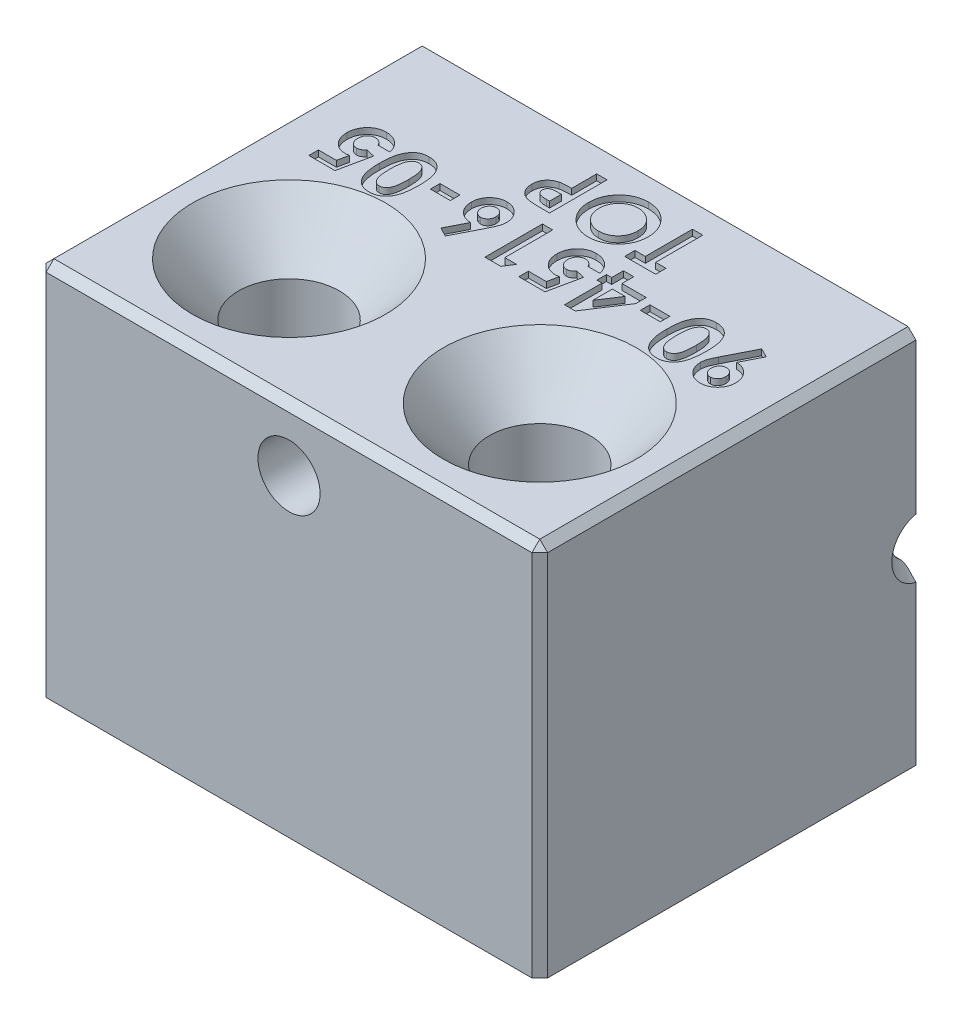
from build123d import *

# Parameters (mm, degrees)
CROQUIS1_W                                           = 25.4
CROQUIS1_H                                           = 19.05
SALIENTE_EXTRUIR1_DEPTH                              = 19.05
AVELLANADO_PARA_TORNILLO_CON_CABEZA_OVAL_D           = 5.1054
AVELLANADO_PARA_TORNILLO_CON_CABEZA_OVAL_CSINK_D     = 9.779
AVELLANADO_PARA_TORNILLO_CON_CABEZA_OVAL_CSINK_ANGLE = 82
CROQUIS6_R                                           = 7.112
CORTAR_EXTRUIR2_DEPTH                                = 6.35
CORTAR_EXTRUIR2_TAPER                                = 45
CROQUIS8_R                                           = 0.8636
CORTAR_EXTRUIR3_DEPTH                                = 34.147973166
REDONDEO1_R                                          = 0.508
CHAFL_N3_SIZE                                        = 0.6604
TALADROS_DE_ESPIGA_DE_1_8_0_124_2_D                  = 3.1496
CROQUIS11_W                                          = 1.007451923
CROQUIS11_H                                          = 0.485069445
CORTAR_EXTRUIR4_DEPTH                                = 0.3048
CHAFL_N4_SIZE                                        = 0.396875


with BuildPart() as part:
    # Croquis1 → Saliente-Extruir1 (new body)
    with BuildSketch(Plane(origin=(0, 0, 0), x_dir=(1, 0, 0), z_dir=(0, 1, 0))):
        Rectangle(CROQUIS1_W, CROQUIS1_H)
    extrude(amount=SALIENTE_EXTRUIR1_DEPTH)

    # Avellanado para tornillo con cabeza ovalada de #101 (through all)
    with Locations(Plane(origin=(0, 19.05, 0), x_dir=(1, 0, 0), z_dir=(0, 1, 0))):
        with Locations((-6.35, -3.175), (6.35, -3.175)):
            CounterSinkHole(AVELLANADO_PARA_TORNILLO_CON_CABEZA_OVAL_D / 2, AVELLANADO_PARA_TORNILLO_CON_CABEZA_OVAL_CSINK_D / 2, counter_sink_angle=AVELLANADO_PARA_TORNILLO_CON_CABEZA_OVAL_CSINK_ANGLE)

    # Croquis6 → Cortar-Extruir2 (cut)
    with BuildSketch(Plane(origin=(-12.7, 0, 0), x_dir=(0, 0, -1), z_dir=(1, 0, 0))):
        with Locations((9.525, 9.525)):
            Circle(CROQUIS6_R)
    extrude(amount=CORTAR_EXTRUIR2_DEPTH, taper=CORTAR_EXTRUIR2_TAPER, mode=Mode.SUBTRACT)

    # Croquis8 → Cortar-Extruir3 (cut, through all)
    with BuildSketch(Plane(origin=(12.7, 0, 0), x_dir=(0, 0, -1), z_dir=(1, 0, 0))):
        with Locations((9.8298, 9.525)):
            Circle(CROQUIS8_R)
    extrude(amount=-CORTAR_EXTRUIR3_DEPTH, mode=Mode.SUBTRACT)

    # Redondeo1
    redondeo1_edges = [part.edges().sort_by_distance(p)[0] for p in [
        (3.151988267, 10.333023465, -9.525),
        (3.151988267, 8.716976535, -9.525),
    ]]
    fillet(redondeo1_edges, radius=REDONDEO1_R)

    # Chaflán3
    # the kernel refuses this chamfer: 0.6604 mm, written as the material it takes off along each edge
    with BuildSketch(Plane(origin=(12.7, 9.525, -9.8298), x_dir=(0, 0.2351427909477186, -0.9719608365903007), z_dir=(0, -0.9719608365903007, -0.2351427909477186))) as chafl_n3_piece_1:
        Polygon((0.8636 + CHAFL_N3_SIZE, 0), (0.8636, -CHAFL_N3_SIZE), (0.8636, 0), align=None)
    revolve(axis=Axis((12.7, 9.525, -9.8298), (1, 0, 0)), revolution_arc=332.799920084, mode=Mode.SUBTRACT)

    # Taladros de espiga de 1/8 (0.124)2 (through all)
    with Locations(Plane.XY.offset(9.525)):
        with Locations((0, 15.875)):
            Hole(TALADROS_DE_ESPIGA_DE_1_8_0_124_2_D / 2)

    # Croquis11 → Cortar-Extruir4 (cut)
    # profile 1 of 13: a face of its own
    with BuildSketch(Plane(origin=(0, 19.05, 0), x_dir=(1, 0, 0), z_dir=(0, 1, 0))):
        with BuildLine():
            Line((9.577789463, 4.837126068), (10.040704294, 4.603919605))
            Line((10.040704294, 4.603919605), (9.533480235, 3.60579594))
            add(Edge.make_bspline(
                [(9.533480235, 3.60579594), (9.563448151, 3.605032039), (9.622282421, 3.603532316), (9.708912078, 3.591071396), (9.79175089, 3.569795359), (9.871789683, 3.541486874), (9.947868003, 3.503479265), (10.021214324, 3.458267026), (10.08991352, 3.403116411), (10.155610898, 3.3420509), (10.215039209, 3.27437186), (10.267524351, 3.202058036), (10.311966693, 3.125805433), (10.347643135, 3.045101646), (10.375663566, 2.960750955), (10.396330159, 2.872422475), (10.407892867, 2.779776454), (10.409512185, 2.716727179), (10.410336538, 2.684630409)],
                knots=[0, 0, 0, 0, 1.014438208, 1.991587644, 2.955575466, 3.906834206, 4.860343588, 5.829907848, 6.818577787, 7.838125475, 8.863876483, 9.862937823, 10.859547262, 11.846397878, 12.845242478, 13.865236027, 14.913246352, 16, 16, 16, 16], degree=3))
            add(Edge.make_bspline(
                [(10.410336538, 2.684630409), (10.409573729, 2.653495901), (10.408070628, 2.592145999), (10.395554211, 2.502114167), (10.375037279, 2.415632496), (10.34654624, 2.332727926), (10.309665397, 2.253544829), (10.264124726, 2.178415871), (10.211148448, 2.106509365), (10.150056989, 2.039510929), (10.083930079, 1.978163774), (10.013245825, 1.924776205), (9.939828617, 1.87873473), (9.862104989, 1.842156005), (9.781495191, 1.812463397), (9.696932133, 1.792376454), (9.609268662, 1.779720186), (9.549654258, 1.778217608), (9.519487847, 1.777457265)],
                knots=[0, 0, 0, 0, 1.05547428, 2.079790231, 3.075662031, 4.065650429, 5.047466705, 6.031911617, 7.04026589, 8.071428158, 9.102169131, 10.094698886, 11.071325611, 12.035261792, 13.002593907, 13.979242867, 14.977445265, 16, 16, 16, 16], degree=3))
            add(Edge.make_bspline(
                [(9.519487847, 1.777457265), (9.487952388, 1.778106656), (9.425942175, 1.779383596), (9.335164644, 1.793464624), (9.248323544, 1.815087058), (9.165013381, 1.844385431), (9.086555771, 1.884358568), (9.011455772, 1.931317465), (8.941168862, 1.988182894), (8.875334679, 2.052157374), (8.816066917, 2.122334502), (8.763226354, 2.195185927), (8.718310177, 2.270936113), (8.682431228, 2.349637811), (8.653902647, 2.430750253), (8.634463923, 2.514452874), (8.621524541, 2.600663398), (8.620054757, 2.65912436), (8.619310897, 2.688711522)],
                knots=[0, 0, 0, 0, 1.062709067, 2.08967359, 3.089490552, 4.078335371, 5.060205664, 6.052952122, 7.060109841, 8.102908433, 9.144326257, 10.153805576, 11.135063239, 12.108674621, 13.066249871, 14.029571809, 15.002763993, 16, 16, 16, 16], degree=3))
            add(Edge.make_bspline(
                [(8.619310897, 2.688711522), (8.619719437, 2.711276442), (8.620542329, 2.756727266), (8.628532622, 2.824700174), (8.640822501, 2.89284773), (8.655155237, 2.950249112), (8.669572085, 2.998831209), (8.684563196, 3.039928146), (8.702643179, 3.085723191), (8.723569729, 3.136286822), (8.747510973, 3.19136855), (8.775282981, 3.250776954), (8.805131663, 3.31542236), (8.827136705, 3.359624711), (8.838524973, 3.382500751)],
                knots=[0, 0, 0, 0, 1.105166677, 2.22605417, 3.348517788, 4.496260522, 5.122810462, 5.830557215, 6.638607343, 7.535109037, 8.511576286, 9.580928918, 10.748058253, 12, 12, 12, 12], degree=3))
            Line((8.838524973, 3.382500751), (9.577789463, 4.837126068))
        make_face()
        with BuildLine():
            add(Edge.make_bspline(
                [(9.507827524, 3.120726496), (9.482795045, 3.11925523), (9.433887248, 3.116380711), (9.363669857, 3.09408565), (9.30057588, 3.056049176), (9.245231346, 3.004811297), (9.19915939, 2.943213682), (9.165400287, 2.873227517), (9.144932888, 2.795967391), (9.142793956, 2.742087786), (9.141693376, 2.714364233)],
                knots=[0, 0, 0, 0, 0.984989413, 1.924446292, 2.868477643, 3.865502828, 4.877610339, 5.88087679, 6.909612885, 8, 8, 8, 8], degree=3))
            add(Edge.make_bspline(
                [(9.141693376, 2.714364233), (9.142994568, 2.68605368), (9.145525697, 2.630982896), (9.166529174, 2.551919907), (9.201282439, 2.480001458), (9.249824037, 2.417666835), (9.306830128, 2.365927934), (9.370038466, 2.327663681), (9.438400041, 2.304156881), (9.485687237, 2.301288726), (9.509576573, 2.299839744)],
                knots=[0, 0, 0, 0, 1.10379546, 2.14714571, 3.168417875, 4.20176326, 5.211701457, 6.157576563, 7.069213742, 8, 8, 8, 8], degree=3))
            add(Edge.make_bspline(
                [(9.509576573, 2.299839744), (9.534825447, 2.301253068), (9.584401405, 2.304028119), (9.655559168, 2.327469177), (9.720858364, 2.364895485), (9.77874715, 2.41654012), (9.827685766, 2.478548122), (9.86248368, 2.550408234), (9.884294391, 2.629139345), (9.886712236, 2.684289592), (9.88795406, 2.712615184)],
                knots=[0, 0, 0, 0, 0.970853505, 1.906262912, 2.855477211, 3.852937491, 4.877462982, 5.878766514, 6.910518104, 8, 8, 8, 8], degree=3))
            add(Edge.make_bspline(
                [(9.88795406, 2.712615184), (9.886582137, 2.740517465), (9.883916325, 2.794734968), (9.863924526, 2.872907949), (9.828743893, 2.943141503), (9.78143682, 3.00505469), (9.724224966, 3.056280847), (9.658567158, 3.094384581), (9.585178842, 3.116333746), (9.534012254, 3.119239476), (9.507827524, 3.120726496)],
                knots=[0, 0, 0, 0, 1.075564157, 2.089951178, 3.085472164, 4.085356838, 5.078137244, 6.028240785, 6.99094342, 8, 8, 8, 8], degree=3))
        make_face(mode=Mode.SUBTRACT)
    # profile 2 of 13: a face of its own
    with BuildSketch(Plane(origin=(0, 19.05, 0), x_dir=(1, 0, 0), z_dir=(0, 1, 0))):
        with BuildLine():
            add(Edge.make_bspline(
                [(7.303443426, 1.777457265), (7.278157881, 1.77783251), (7.228439743, 1.778570343), (7.155215401, 1.786566107), (7.08467583, 1.79863628), (7.016565039, 1.815502545), (6.951300749, 1.837707433), (6.88860013, 1.864735669), (6.828309878, 1.896085583), (6.770975299, 1.933017916), (6.71682924, 1.975040034), (6.665498574, 2.022025215), (6.618042906, 2.074736225), (6.572776059, 2.13188631), (6.531493699, 2.194734624), (6.493018566, 2.262255631), (6.457935714, 2.335171172), (6.425755776, 2.413531194), (6.39696918, 2.498530334), (6.372790314, 2.591151055), (6.351770035, 2.691327551), (6.335215941, 2.799581534), (6.321666816, 2.915657696), (6.312813966, 3.039773229), (6.306655314, 3.171580804), (6.306158182, 3.262002964), (6.305902778, 3.308457699)],
                knots=[0, 0, 0, 0, 0.879038005, 1.72842358, 2.558443055, 3.366573136, 4.165922485, 4.953092809, 5.739101687, 6.526504095, 7.321412341, 8.120218626, 8.943108119, 9.785446297, 10.653345205, 11.555363108, 12.486387694, 13.465363381, 14.499809521, 15.604758044, 16.79243262, 18.058048538, 19.411969755, 20.855614229, 22.384559651, 24, 24, 24, 24], degree=3))
            add(Edge.make_bspline(
                [(6.305902778, 3.308457699), (6.30618078, 3.355493333), (6.306720933, 3.446882727), (6.312539159, 3.579900007), (6.322561587, 3.704902354), (6.335469274, 3.821880127), (6.353183482, 3.930760397), (6.37378088, 4.031678931), (6.398613648, 4.124661507), (6.428192408, 4.209693066), (6.460341747, 4.288314568), (6.495211194, 4.361120545), (6.532778164, 4.428681974), (6.572635594, 4.491157023), (6.616097425, 4.547771499), (6.661366848, 4.599351895), (6.709735991, 4.64517628), (6.760423898, 4.686227022), (6.814677143, 4.722158218), (6.872253198, 4.753028481), (6.933541606, 4.778539733), (6.997650491, 4.800528892), (7.065720417, 4.816349019), (7.136700339, 4.828891434), (7.211382998, 4.835825388), (7.262230296, 4.836685393), (7.288285006, 4.837126068)],
                knots=[0, 0, 0, 0, 1.643729521, 3.193736973, 4.651750042, 6.025799905, 7.305391353, 8.505533933, 9.624215592, 10.665924642, 11.64969722, 12.591402044, 13.485259159, 14.34997443, 15.17859563, 15.977254476, 16.745893235, 17.504291679, 18.254003551, 19.016677942, 19.783634514, 20.571857866, 21.382327253, 22.223106266, 23.08950026, 24, 24, 24, 24], degree=3))
            add(Edge.make_bspline(
                [(7.288285006, 4.837126068), (7.314338454, 4.836674907), (7.365376774, 4.835791087), (7.440269243, 4.828965006), (7.511783222, 4.816186583), (7.580495193, 4.800641949), (7.645751621, 4.77837586), (7.708295634, 4.752632302), (7.76705824, 4.720755476), (7.823123917, 4.685137239), (7.875595572, 4.644080672), (7.925254138, 4.598240661), (7.972793395, 4.54825711), (8.016519925, 4.492393926), (8.057215636, 4.431671333), (8.095312847, 4.366097865), (8.130036079, 4.29545891), (8.162553151, 4.219774559), (8.191301043, 4.137224752), (8.216176269, 4.047049902), (8.23689715, 3.948475347), (8.254636576, 3.84193807), (8.266664153, 3.726824151), (8.276917028, 3.603812197), (8.282660924, 3.472534433), (8.283210589, 3.382311557), (8.28349359, 3.335859458)],
                knots=[0, 0, 0, 0, 0.917300563, 1.796978314, 2.644037383, 3.473869551, 4.274468802, 5.068727038, 5.852392514, 6.624895937, 7.405058545, 8.194438634, 9.002807344, 9.831001702, 10.688798588, 11.574866558, 12.499006576, 13.458565112, 14.473491784, 15.574131657, 16.749764288, 18.018652109, 19.374999853, 20.823441246, 22.364518758, 24, 24, 24, 24], degree=3))
            add(Edge.make_bspline(
                [(8.28349359, 3.335859458), (8.282986796, 3.271318161), (8.282008931, 3.146784895), (8.269934427, 2.966845157), (8.251668988, 2.800645301), (8.226665004, 2.647984512), (8.192987364, 2.509161597), (8.151657606, 2.384216429), (8.104234479, 2.271912213), (8.063888136, 2.205371742), (8.044456964, 2.173325237)],
                knots=[0, 0, 0, 0, 1.288526675, 2.486228817, 3.599112392, 4.626206381, 5.5730174, 6.447949553, 7.252518174, 8, 8, 8, 8], degree=3))
            add(Edge.make_bspline(
                [(8.044456964, 2.173325237), (8.021858808, 2.141843633), (7.97767496, 2.080290894), (7.900418265, 1.999483652), (7.817416006, 1.930373343), (7.726963363, 1.874523993), (7.630490881, 1.830481191), (7.527170297, 1.799374256), (7.417383155, 1.781249906), (7.341990493, 1.778740357), (7.303443426, 1.777457265)],
                knots=[0, 0, 0, 0, 1.058512271, 2.069600068, 3.047294572, 4.004278952, 4.967380941, 5.939006123, 6.946246673, 8, 8, 8, 8], degree=3))
        make_face()
        with BuildLine():
            add(Edge.make_bspline(
                [(7.290617071, 2.299839744), (7.313468797, 2.300934808), (7.358270311, 2.303081716), (7.423220721, 2.320898777), (7.483929965, 2.349226698), (7.530916451, 2.381780465), (7.565530998, 2.414214271), (7.590735326, 2.442634643), (7.613299183, 2.475900094), (7.635045037, 2.512555538), (7.654590796, 2.553718147), (7.673425893, 2.598284297), (7.689520908, 2.647372353), (7.704907809, 2.700562017), (7.71818717, 2.759169969), (7.729892653, 2.823744276), (7.739511324, 2.894571025), (7.747903063, 2.971728405), (7.753162035, 3.055199181), (7.758277014, 3.144962685), (7.760135096, 3.241209991), (7.760778875, 3.307486291), (7.761111111, 3.34168962)],
                knots=[0, 0, 0, 0, 1.076633864, 2.110773886, 3.152647947, 4.225997476, 4.790367519, 5.388085217, 6.013768813, 6.68363944, 7.397140436, 8.161658524, 8.964785566, 9.832512219, 10.773307679, 11.798385074, 12.927758018, 14.144797317, 15.459104848, 16.872968649, 18.386227327, 20, 20, 20, 20], degree=3))
            add(Edge.make_bspline(
                [(7.761111111, 3.34168962), (7.760577648, 3.386002618), (7.759554693, 3.470976078), (7.754212116, 3.5931703), (7.743439005, 3.704570524), (7.730181026, 3.805539605), (7.711607657, 3.895760226), (7.688865447, 3.975209662), (7.663524956, 4.044779459), (7.631768441, 4.103277181), (7.597741001, 4.153304234), (7.561422801, 4.196580256), (7.522179554, 4.232629679), (7.481184469, 4.263234929), (7.43691722, 4.285961115), (7.390285537, 4.302529237), (7.341185898, 4.312631213), (7.307570789, 4.314035394), (7.290617071, 4.31474359)],
                knots=[0, 0, 0, 0, 1.772038313, 3.39801485, 4.888833602, 6.246074539, 7.468356166, 8.567794639, 9.549176812, 10.42180448, 11.221452581, 11.965716786, 12.675085657, 13.348110381, 14.005015947, 14.656336226, 15.322325655, 16, 16, 16, 16], degree=3))
            add(Edge.make_bspline(
                [(7.290617071, 4.31474359), (7.274244519, 4.314259564), (7.242189098, 4.313311902), (7.195445116, 4.303584279), (7.151240685, 4.287769276), (7.109709272, 4.265397844), (7.070702325, 4.236949145), (7.034410487, 4.202298164), (7.001107461, 4.161099511), (6.981704968, 4.130524018), (6.971707232, 4.114769047)],
                knots=[0, 0, 0, 0, 0.992283464, 1.942767638, 2.88273346, 3.832339453, 4.79467288, 5.803907806, 6.868395428, 8, 8, 8, 8], degree=3))
            add(Edge.make_bspline(
                [(6.971707232, 4.114769047), (6.959932946, 4.093241103), (6.935243224, 4.04809875), (6.906744692, 3.971907565), (6.88243326, 3.886084728), (6.862944556, 3.789936313), (6.847508193, 3.68384811), (6.835707092, 3.567741271), (6.829712915, 3.441449371), (6.828773489, 3.353938339), (6.828285256, 3.308457699)],
                knots=[0, 0, 0, 0, 0.710996797, 1.490902623, 2.352723643, 3.296875318, 4.334065587, 5.461510359, 6.680713396, 8, 8, 8, 8], degree=3))
            add(Edge.make_bspline(
                [(6.828285256, 3.308457699), (6.828477215, 3.262583677), (6.828846704, 3.174284015), (6.835625755, 3.047519468), (6.845066087, 2.931741075), (6.858874615, 2.827207399), (6.876641652, 2.733664431), (6.898540044, 2.651119071), (6.92435521, 2.57940616), (6.95497336, 2.518604993), (6.988870879, 2.466914049), (7.024900292, 2.422628479), (7.063123905, 2.384502057), (7.103953558, 2.353598974), (7.147116775, 2.328968428), (7.19284644, 2.312183233), (7.24099043, 2.301857545), (7.273851579, 2.300521422), (7.290617071, 2.299839744)],
                knots=[0, 0, 0, 0, 1.793903324, 3.452957663, 4.963427329, 6.336122014, 7.574844885, 8.684777121, 9.673127442, 10.55010789, 11.340650774, 12.086136756, 12.779466299, 13.446812155, 14.083183996, 14.715685896, 15.34475337, 16, 16, 16, 16], degree=3))
        make_face(mode=Mode.SUBTRACT)
    # profile 3 of 13: a face of its own
    with BuildSketch(Plane(origin=(0, 19.05, 0), x_dir=(1, 0, 0), z_dir=(0, 1, 0))):
        with Locations((5.317107372, 3.699078526)):
            Rectangle(CROQUIS11_W, CROQUIS11_H)
    # profile 4 of 13: a face of its own
    with BuildSketch(Plane(origin=(0, 19.05, 0), x_dir=(1, 0, 0), z_dir=(0, 1, 0))):
        Polygon((3.19376252, 1.777457265), (2.649225427, 1.777457265), (2.649225427, 3.680422009), (2.388034188, 3.680422009), (2.388034188, 4.165491453), (2.649225427, 4.165491453), (2.649225427, 4.7625), (3.171607906, 4.7625), (3.171607906, 4.165491453), (4.402938034, 4.165491453), (4.402938034, 3.636695797), align=None)
        Polygon((3.171607906, 3.680422009), (3.171607906, 2.689877554), (3.815840762, 3.680422009), align=None, mode=Mode.SUBTRACT)
    # profile 5 of 13: a face of its own
    with BuildSketch(Plane(origin=(0, 19.05, 0), x_dir=(1, 0, 0), z_dir=(0, 1, 0))):
        with BuildLine():
            Line((1.586386969, 1.852083333), (0.261191239, 1.852083333))
            Line((0.261191239, 1.852083333), (0.261191239, 2.337152778))
            Line((0.261191239, 2.337152778), (1.172445496, 2.337152778))
            Line((1.172445496, 2.337152778), (1.286133647, 2.887520032))
            add(Edge.make_bspline(
                [(1.286133647, 2.887520032), (1.270644234, 2.883192597), (1.239911903, 2.874606592), (1.193848433, 2.866282107), (1.149266002, 2.860590662), (1.12018495, 2.859881576), (1.105981654, 2.859535256)],
                knots=[0, 0, 0, 0, 1.054652254, 2.092520994, 3.068380062, 4, 4, 4, 4], degree=3))
            add(Edge.make_bspline(
                [(1.105981654, 2.859535256), (1.075034497, 2.860244393), (1.014030833, 2.861642256), (0.924790213, 2.874912541), (0.839337048, 2.895812838), (0.757932834, 2.925620974), (0.680657091, 2.964417033), (0.607416147, 3.011349388), (0.53812011, 3.066500471), (0.473999969, 3.12990481), (0.415083705, 3.19952421), (0.363859374, 3.274824958), (0.320110599, 3.354733338), (0.285314336, 3.439746059), (0.257850158, 3.529329183), (0.23800393, 3.62354012), (0.226267864, 3.722490522), (0.224685328, 3.789997306), (0.223878205, 3.824427)],
                knots=[0, 0, 0, 0, 1.01440847, 1.999622559, 2.951875003, 3.895578053, 4.836219714, 5.782137149, 6.743708247, 7.735272588, 8.734977101, 9.730283169, 10.717124674, 11.717316708, 12.737475749, 13.78628267, 14.87096371, 16, 16, 16, 16], degree=3))
            add(Edge.make_bspline(
                [(0.223878205, 3.824427), (0.224859462, 3.859249276), (0.22679577, 3.927963806), (0.239566179, 4.028968685), (0.261726495, 4.12588368), (0.293426842, 4.218122053), (0.333430172, 4.306359338), (0.381709539, 4.390702895), (0.440071599, 4.470213347), (0.506127178, 4.544852088), (0.578200184, 4.613129405), (0.655137662, 4.673034195), (0.735639071, 4.724335627), (0.820845778, 4.765023725), (0.909454054, 4.797377472), (1.001771645, 4.820879634), (1.098196724, 4.834368252), (1.163658697, 4.836196695), (1.196932175, 4.837126068)],
                knots=[0, 0, 0, 0, 1.068252361, 2.107974174, 3.117445057, 4.112928197, 5.094821713, 6.085741881, 7.08864209, 8.115013732, 9.139860459, 10.12970393, 11.102304324, 12.062250553, 13.020362151, 13.992066755, 14.979393365, 16, 16, 16, 16], degree=3))
            add(Edge.make_bspline(
                [(1.196932175, 4.837126068), (1.226681741, 4.836340697), (1.285354112, 4.834791779), (1.371913603, 4.825925808), (1.45493078, 4.808318076), (1.53522415, 4.786212078), (1.611683596, 4.755740209), (1.685884681, 4.720723006), (1.755593695, 4.676759574), (1.822791038, 4.628327453), (1.884893425, 4.573323548), (1.942553685, 4.513886573), (1.993578463, 4.448905489), (2.039868763, 4.379643281), (2.078909492, 4.304806679), (2.11380964, 4.225741839), (2.142321021, 4.141558787), (2.156798607, 4.083206463), (2.164155983, 4.05355235)],
                knots=[0, 0, 0, 0, 1.055144606, 2.080965977, 3.079696235, 4.061281178, 5.030010203, 5.994686618, 6.966205752, 7.947572972, 8.929036963, 9.903776773, 10.879904045, 11.854643856, 12.853445432, 13.868704235, 14.916895142, 16, 16, 16, 16], degree=3))
            Line((2.164155983, 4.05355235), (1.567147436, 4.05355235))
            add(Edge.make_bspline(
                [(1.567147436, 4.05355235), (1.556239394, 4.074109314), (1.535040861, 4.114059427), (1.494624095, 4.166978093), (1.449695944, 4.212587822), (1.39906223, 4.249182904), (1.345412149, 4.278514515), (1.288628767, 4.30003615), (1.22875724, 4.312400811), (1.187853539, 4.313957504), (1.167198351, 4.31474359)],
                knots=[0, 0, 0, 0, 1.105237818, 2.14790357, 3.154462025, 4.139874369, 5.10774607, 6.055457142, 7.018062016, 8, 8, 8, 8], degree=3))
            add(Edge.make_bspline(
                [(1.167198351, 4.31474359), (1.152802453, 4.314201772), (1.124478281, 4.313135735), (1.082745139, 4.307500424), (1.04291657, 4.296813406), (1.00466057, 4.282061015), (0.967863606, 4.263418862), (0.932711035, 4.240513773), (0.899379036, 4.213489849), (0.867978687, 4.182784731), (0.839636826, 4.148466435), (0.814566825, 4.111831608), (0.793120967, 4.072912164), (0.776451138, 4.031279018), (0.762999083, 3.987394976), (0.753034001, 3.941204794), (0.747092797, 3.892602305), (0.74654177, 3.859424776), (0.746260684, 3.842500501)],
                knots=[0, 0, 0, 0, 0.978584799, 1.925382083, 2.854237347, 3.773848163, 4.706917643, 5.651871472, 6.619075428, 7.618203006, 8.630937754, 9.638147826, 10.630884984, 11.643619732, 12.679505692, 13.746568031, 14.850495961, 16, 16, 16, 16], degree=3))
            add(Edge.make_bspline(
                [(0.746260684, 3.842500501), (0.74649656, 3.825956457), (0.746956026, 3.793730136), (0.753455611, 3.746668204), (0.761600098, 3.70161534), (0.774765964, 3.658993153), (0.790829208, 3.618325345), (0.811829261, 3.580555673), (0.834623885, 3.543950435), (0.862388572, 3.511175607), (0.891720453, 3.480825578), (0.923372491, 3.454427839), (0.956643639, 3.432205608), (0.991499075, 3.414052178), (1.027612472, 3.399010575), (1.065800415, 3.389662373), (1.105133397, 3.382527049), (1.131988343, 3.382122956), (1.145626753, 3.381917735)],
                knots=[0, 0, 0, 0, 1.166510573, 2.272258428, 3.34817395, 4.393855846, 5.415148486, 6.427654656, 7.43960333, 8.452852352, 9.451798603, 10.415864797, 11.355425197, 12.269514664, 13.186377996, 14.107845883, 15.039060727, 16, 16, 16, 16], degree=3))
            add(Edge.make_bspline(
                [(1.145626753, 3.381917735), (1.160443895, 3.382464484), (1.190140626, 3.383560286), (1.234109377, 3.392945122), (1.277935666, 3.406835654), (1.321049341, 3.427576597), (1.363855873, 3.4541884), (1.406428946, 3.486340103), (1.448596347, 3.524545608), (1.475239772, 3.553118312), (1.489023271, 3.56789989)],
                knots=[0, 0, 0, 0, 0.882519632, 1.768758668, 2.670168731, 3.618680561, 4.612333577, 5.671392632, 6.795336641, 8, 8, 8, 8], degree=3))
            Line((1.489023271, 3.56789989), (1.928617455, 3.467038094))
            Line((1.928617455, 3.467038094), (1.586386969, 1.852083333))
        make_face()
    # profile 6 of 13: a face of its own
    with BuildSketch(Plane(origin=(0, 19.05, 0), x_dir=(1, 0, 0), z_dir=(0, 1, 0))):
        Polygon((-0.647730953, 1.852083333), (-1.455208333, 1.852083333), (-1.455208333, 4.7625), (-0.932825855, 4.7625), (-0.932825855, 2.337152778), (-0.335817308, 2.337152778), align=None)
    # profile 7 of 13: a face of its own
    with BuildSketch(Plane(origin=(0, 19.05, 0), x_dir=(1, 0, 0), z_dir=(0, 1, 0))):
        with BuildLine():
            Line((-3.383825788, 1.777457265), (-3.846157602, 2.011829761))
            Line((-3.846157602, 2.011829761), (-3.338933544, 3.008787393))
            add(Edge.make_bspline(
                [(-3.338933544, 3.008787393), (-3.368902062, 3.009557584), (-3.427929975, 3.011074601), (-3.514739707, 3.023506389), (-3.597942185, 3.044575577), (-3.677533967, 3.073978786), (-3.754083483, 3.110919187), (-3.82721912, 3.156381155), (-3.895967069, 3.211443073), (-3.961609905, 3.272561141), (-4.021310866, 3.340240074), (-4.073168518, 3.412971413), (-4.118362385, 3.488975889), (-4.153494075, 3.569956475), (-4.181832522, 3.654570152), (-4.202279945, 3.743155339), (-4.213945775, 3.835968509), (-4.215554104, 3.899020701), (-4.216372863, 3.931118957)],
                knots=[0, 0, 0, 0, 1.013301021, 1.995862538, 2.958769729, 3.911210226, 4.860765807, 5.829243184, 6.816804824, 7.835209597, 8.859810738, 9.863084768, 10.852896952, 11.844649668, 12.842374562, 13.8676291, 14.914464604, 16, 16, 16, 16], degree=3))
            add(Edge.make_bspline(
                [(-4.216372863, 3.931118957), (-4.215603005, 3.962058689), (-4.214081326, 4.023213273), (-4.201583016, 4.113051806), (-4.181143988, 4.199356213), (-4.152665065, 4.281921499), (-4.115243236, 4.360467817), (-4.07124118, 4.436217787), (-4.017481061, 4.507479536), (-3.956742568, 4.574550258), (-3.890269616, 4.635908752), (-3.819746845, 4.689857701), (-3.745495571, 4.734953879), (-3.668469825, 4.772826339), (-3.587277356, 4.801122287), (-3.503091474, 4.82247137), (-3.415285053, 4.834792842), (-3.355683885, 4.836342103), (-3.325524172, 4.837126068)],
                knots=[0, 0, 0, 0, 1.049794856, 2.07499426, 3.07172498, 4.056334273, 5.03302406, 6.020611576, 7.024540571, 8.056592197, 9.088222165, 10.090850172, 11.06486348, 12.032490482, 12.998429859, 13.977500003, 14.976563331, 16, 16, 16, 16], degree=3))
            add(Edge.make_bspline(
                [(-3.325524172, 4.837126068), (-3.293988546, 4.836476939), (-3.231978005, 4.835200514), (-3.141202849, 4.821115759), (-3.054353053, 4.799506974), (-2.971074791, 4.77015853), (-2.892405402, 4.730324043), (-2.817673503, 4.682591544), (-2.747177583, 4.6258612), (-2.681376926, 4.561831756), (-2.622107509, 4.491666103), (-2.569240951, 4.418823597), (-2.524516565, 4.343180516), (-2.48831302, 4.264820167), (-2.460066224, 4.183991618), (-2.440412204, 4.10054163), (-2.427605799, 4.014691509), (-2.426104539, 3.956428761), (-2.425347222, 3.927037844)],
                knots=[0, 0, 0, 0, 1.063729824, 2.091680771, 3.092458079, 4.082252707, 5.065066109, 6.062289472, 7.070414589, 8.114214813, 9.156632944, 10.167081891, 11.149282074, 12.117871028, 13.076366051, 14.034232288, 15.008359245, 16, 16, 16, 16], degree=3))
            add(Edge.make_bspline(
                [(-2.425347222, 3.927037844), (-2.425747359, 3.904278011), (-2.426549861, 3.858631654), (-2.434615028, 3.790278824), (-2.446875751, 3.721746133), (-2.461091204, 3.663917507), (-2.475719944, 3.615013828), (-2.490473156, 3.573639836), (-2.508558179, 3.527836345), (-2.529870927, 3.477437003), (-2.553527481, 3.422044775), (-2.58102781, 3.362309249), (-2.611476346, 3.297753961), (-2.633227323, 3.253429877), (-2.644561298, 3.230333534)],
                knots=[0, 0, 0, 0, 1.110459156, 2.227099586, 3.354645278, 4.50724841, 5.131424341, 5.845429508, 6.650417918, 7.534765369, 8.5162346, 9.590157747, 10.744282107, 12, 12, 12, 12], degree=3))
            Line((-2.644561298, 3.230333534), (-3.383825788, 1.777457265))
        make_face()
        with BuildLine():
            add(Edge.make_bspline(
                [(-3.313863849, 3.493856838), (-3.288800426, 3.49500887), (-3.239754598, 3.497263247), (-3.1699835, 3.520791341), (-3.106621712, 3.557813271), (-3.05112484, 3.608661598), (-3.005048048, 3.670328046), (-2.971450827, 3.740803863), (-2.950916277, 3.818810855), (-2.948814628, 3.873271228), (-2.947729701, 3.901385133)],
                knots=[0, 0, 0, 0, 0.981531227, 1.92072777, 2.858278205, 3.847411092, 4.856727683, 5.864107753, 6.897395173, 8, 8, 8, 8], degree=3))
            add(Edge.make_bspline(
                [(-2.947729701, 3.901385133), (-2.949046528, 3.929494702), (-2.951607844, 3.984169692), (-2.972415009, 4.062851267), (-3.008144356, 4.134007701), (-3.056580364, 4.196124926), (-3.11270458, 4.248862387), (-3.176117852, 4.286869887), (-3.244425505, 4.310439003), (-3.291719916, 4.31329882), (-3.315612897, 4.31474359)],
                knots=[0, 0, 0, 0, 1.098824389, 2.137286887, 3.15751972, 4.193305908, 5.205115386, 6.153224686, 7.067015188, 8, 8, 8, 8], degree=3))
            add(Edge.make_bspline(
                [(-3.315612897, 4.31474359), (-3.340842624, 4.313268746), (-3.390322501, 4.310376323), (-3.461702647, 4.287859412), (-3.526900085, 4.250233238), (-3.584581618, 4.198671742), (-3.633887127, 4.137140489), (-3.668611609, 4.06515937), (-3.690370229, 3.985826935), (-3.692759357, 3.930099422), (-3.693990385, 3.901385133)],
                knots=[0, 0, 0, 0, 0.969156912, 1.90068503, 2.84824055, 3.843957741, 4.860802806, 5.860356532, 6.897522282, 8, 8, 8, 8], degree=3))
            add(Edge.make_bspline(
                [(-3.693990385, 3.901385133), (-3.69271479, 3.873261784), (-3.690242203, 3.81874807), (-3.669064177, 3.740769552), (-3.634938416, 3.670115705), (-3.58755816, 3.608457395), (-3.530179947, 3.55737161), (-3.464005057, 3.520790257), (-3.391228651, 3.497196866), (-3.34009108, 3.494989131), (-3.313863849, 3.493856838)],
                knots=[0, 0, 0, 0, 1.083267085, 2.099782405, 3.092211101, 4.09231173, 5.080341908, 6.03348511, 6.991421775, 8, 8, 8, 8], degree=3))
        make_face(mode=Mode.SUBTRACT)
    # profile 8 of 13: a face of its own
    with BuildSketch(Plane(origin=(0, 19.05, 0), x_dir=(1, 0, 0), z_dir=(0, 1, 0))):
        with Locations((-5.317107372, 3.699078526)):
            Rectangle(CROQUIS11_W, CROQUIS11_H)
    # profile 9 of 13: a face of its own
    with BuildSketch(Plane(origin=(0, 19.05, 0), x_dir=(1, 0, 0), z_dir=(0, 1, 0))):
        with BuildLine():
            add(Edge.make_bspline(
                [(-7.248639907, 1.777457265), (-7.273925452, 1.77783251), (-7.32364359, 1.778570343), (-7.396867932, 1.786566107), (-7.467407503, 1.79863628), (-7.535518294, 1.815502545), (-7.600782584, 1.837707433), (-7.663483203, 1.864735669), (-7.723773455, 1.896085583), (-7.781108034, 1.933017916), (-7.835254093, 1.975040034), (-7.886584759, 2.022025215), (-7.934040428, 2.074736225), (-7.979307274, 2.13188631), (-8.020589635, 2.194734624), (-8.059064767, 2.262255631), (-8.094147619, 2.335171172), (-8.126327558, 2.413531194), (-8.155114154, 2.498530334), (-8.17929302, 2.591151055), (-8.200313298, 2.691327551), (-8.216867393, 2.799581534), (-8.230416517, 2.915657696), (-8.239269367, 3.039773229), (-8.245428019, 3.171580804), (-8.245925152, 3.262002964), (-8.246180556, 3.308457699)],
                knots=[0, 0, 0, 0, 0.879038005, 1.72842358, 2.558443055, 3.366573136, 4.165922485, 4.953092809, 5.739101687, 6.526504095, 7.321412341, 8.120218626, 8.943108119, 9.785446297, 10.653345205, 11.555363108, 12.486387694, 13.465363381, 14.499809521, 15.604758044, 16.79243262, 18.058048538, 19.411969755, 20.855614229, 22.384559651, 24, 24, 24, 24], degree=3))
            add(Edge.make_bspline(
                [(-8.246180556, 3.308457699), (-8.245902553, 3.355493333), (-8.2453624, 3.446882727), (-8.239544174, 3.579900007), (-8.229521746, 3.704902354), (-8.216614059, 3.821880127), (-8.198899851, 3.930760397), (-8.178302453, 4.031678931), (-8.153469685, 4.124661507), (-8.123890925, 4.209693066), (-8.091741587, 4.288314568), (-8.056872139, 4.361120545), (-8.019305169, 4.428681974), (-7.979447739, 4.491157023), (-7.935985908, 4.547771499), (-7.890716486, 4.599351895), (-7.842347343, 4.64517628), (-7.791659435, 4.686227022), (-7.73740619, 4.722158218), (-7.679830136, 4.753028481), (-7.618541727, 4.778539733), (-7.554432842, 4.800528892), (-7.486362916, 4.816349019), (-7.415382994, 4.828891434), (-7.340700335, 4.835825388), (-7.289853037, 4.836685393), (-7.263798327, 4.837126068)],
                knots=[0, 0, 0, 0, 1.643729521, 3.193736973, 4.651750042, 6.025799905, 7.305391353, 8.505533933, 9.624215592, 10.665924642, 11.64969722, 12.591402044, 13.485259159, 14.34997443, 15.17859563, 15.977254476, 16.745893235, 17.504291679, 18.254003551, 19.016677942, 19.783634514, 20.571857866, 21.382327253, 22.223106266, 23.08950026, 24, 24, 24, 24], degree=3))
            add(Edge.make_bspline(
                [(-7.263798327, 4.837126068), (-7.23774488, 4.836674907), (-7.186706559, 4.835791087), (-7.11181409, 4.828965006), (-7.040300111, 4.816186583), (-6.971588141, 4.800641949), (-6.906331712, 4.77837586), (-6.8437877, 4.752632302), (-6.785025094, 4.720755476), (-6.728959416, 4.685137239), (-6.676487761, 4.644080672), (-6.626829195, 4.598240661), (-6.579289939, 4.54825711), (-6.535563408, 4.492393926), (-6.494867697, 4.431671333), (-6.456770487, 4.366097865), (-6.422047254, 4.29545891), (-6.389530182, 4.219774559), (-6.36078229, 4.137224752), (-6.335907064, 4.047049902), (-6.315186184, 3.948475347), (-6.297446757, 3.84193807), (-6.28541918, 3.726824151), (-6.275166306, 3.603812197), (-6.269422409, 3.472534433), (-6.268872744, 3.382311557), (-6.268589744, 3.335859458)],
                knots=[0, 0, 0, 0, 0.917300563, 1.796978314, 2.644037383, 3.473869551, 4.274468802, 5.068727038, 5.852392514, 6.624895937, 7.405058545, 8.194438634, 9.002807344, 9.831001702, 10.688798588, 11.574866558, 12.499006576, 13.458565112, 14.473491784, 15.574131657, 16.749764288, 18.018652109, 19.374999853, 20.823441246, 22.364518758, 24, 24, 24, 24], degree=3))
            add(Edge.make_bspline(
                [(-6.268589744, 3.335859458), (-6.269096537, 3.271318161), (-6.270074403, 3.146784895), (-6.282148906, 2.966845157), (-6.300414346, 2.800645301), (-6.325418329, 2.647984512), (-6.359095969, 2.509161597), (-6.400425727, 2.384216429), (-6.447848855, 2.271912213), (-6.488195198, 2.205371742), (-6.507626369, 2.173325237)],
                knots=[0, 0, 0, 0, 1.288526675, 2.486228817, 3.599112392, 4.626206381, 5.5730174, 6.447949553, 7.252518174, 8, 8, 8, 8], degree=3))
            add(Edge.make_bspline(
                [(-6.507626369, 2.173325237), (-6.530224525, 2.141843633), (-6.574408374, 2.080290894), (-6.651665068, 1.999483652), (-6.734667327, 1.930373343), (-6.825119971, 1.874523993), (-6.921592452, 1.830481191), (-7.024913037, 1.799374256), (-7.134700179, 1.781249906), (-7.210092841, 1.778740357), (-7.248639907, 1.777457265)],
                knots=[0, 0, 0, 0, 1.058512271, 2.069600068, 3.047294572, 4.004278952, 4.967380941, 5.939006123, 6.946246673, 8, 8, 8, 8], degree=3))
        make_face()
        with BuildLine():
            add(Edge.make_bspline(
                [(-7.261466263, 2.299839744), (-7.238614536, 2.300934808), (-7.193813022, 2.303081716), (-7.128862612, 2.320898777), (-7.068153369, 2.349226698), (-7.021166882, 2.381780465), (-6.986552335, 2.414214271), (-6.961348007, 2.442634643), (-6.938784151, 2.475900094), (-6.917038296, 2.512555538), (-6.897492538, 2.553718147), (-6.878657441, 2.598284297), (-6.862562426, 2.647372353), (-6.847175524, 2.700562017), (-6.833896163, 2.759169969), (-6.82219068, 2.823744276), (-6.81257201, 2.894571025), (-6.804180271, 2.971728405), (-6.798921298, 3.055199181), (-6.793806319, 3.144962685), (-6.791948238, 3.241209991), (-6.791304458, 3.307486291), (-6.790972222, 3.34168962)],
                knots=[0, 0, 0, 0, 1.076633864, 2.110773886, 3.152647947, 4.225997476, 4.790367519, 5.388085217, 6.013768813, 6.68363944, 7.397140436, 8.161658524, 8.964785566, 9.832512219, 10.773307679, 11.798385074, 12.927758018, 14.144797317, 15.459104848, 16.872968649, 18.386227327, 20, 20, 20, 20], degree=3))
            add(Edge.make_bspline(
                [(-6.790972222, 3.34168962), (-6.791505685, 3.386002618), (-6.79252864, 3.470976078), (-6.797871217, 3.5931703), (-6.808644328, 3.704570524), (-6.821902308, 3.805539605), (-6.840475677, 3.895760226), (-6.863217886, 3.975209662), (-6.888558377, 4.044779459), (-6.920314892, 4.103277181), (-6.954342332, 4.153304234), (-6.990660533, 4.196580256), (-7.029903779, 4.232629679), (-7.070898864, 4.263234929), (-7.115166113, 4.285961115), (-7.161797797, 4.302529237), (-7.210897435, 4.312631213), (-7.244512544, 4.314035394), (-7.261466263, 4.31474359)],
                knots=[0, 0, 0, 0, 1.772038313, 3.39801485, 4.888833602, 6.246074539, 7.468356166, 8.567794639, 9.549176812, 10.42180448, 11.221452581, 11.965716786, 12.675085657, 13.348110381, 14.005015947, 14.656336226, 15.322325655, 16, 16, 16, 16], degree=3))
            add(Edge.make_bspline(
                [(-7.261466263, 4.31474359), (-7.277838814, 4.314259564), (-7.309894235, 4.313311902), (-7.356638217, 4.303584279), (-7.400842648, 4.287769276), (-7.442374061, 4.265397844), (-7.481381008, 4.236949145), (-7.517672847, 4.202298164), (-7.550975872, 4.161099511), (-7.570378366, 4.130524018), (-7.580376102, 4.114769047)],
                knots=[0, 0, 0, 0, 0.992283464, 1.942767638, 2.88273346, 3.832339453, 4.79467288, 5.803907806, 6.868395428, 8, 8, 8, 8], degree=3))
            add(Edge.make_bspline(
                [(-7.580376102, 4.114769047), (-7.592150387, 4.093241103), (-7.616840109, 4.04809875), (-7.645338641, 3.971907565), (-7.669650073, 3.886084728), (-7.689138778, 3.789936313), (-7.70457514, 3.68384811), (-7.716376242, 3.567741271), (-7.722370419, 3.441449371), (-7.723309845, 3.353938339), (-7.723798077, 3.308457699)],
                knots=[0, 0, 0, 0, 0.710996797, 1.490902623, 2.352723643, 3.296875318, 4.334065587, 5.461510359, 6.680713396, 8, 8, 8, 8], degree=3))
            add(Edge.make_bspline(
                [(-7.723798077, 3.308457699), (-7.723606118, 3.262583677), (-7.72323663, 3.174284015), (-7.716457579, 3.047519468), (-7.707017246, 2.931741075), (-7.693208718, 2.827207399), (-7.675441682, 2.733664431), (-7.653543289, 2.651119071), (-7.627728123, 2.57940616), (-7.597109974, 2.518604993), (-7.563212455, 2.466914049), (-7.527183041, 2.422628479), (-7.488959429, 2.384502057), (-7.448129776, 2.353598974), (-7.404966558, 2.328968428), (-7.359236893, 2.312183233), (-7.311092903, 2.301857545), (-7.278231754, 2.300521422), (-7.261466263, 2.299839744)],
                knots=[0, 0, 0, 0, 1.793903324, 3.452957663, 4.963427329, 6.336122014, 7.574844885, 8.684777121, 9.673127442, 10.55010789, 11.340650774, 12.086136756, 12.779466299, 13.446812155, 14.083183996, 14.715685896, 15.34475337, 16, 16, 16, 16], degree=3))
        make_face(mode=Mode.SUBTRACT)
    # profile 10 of 13: a face of its own
    with BuildSketch(Plane(origin=(0, 19.05, 0), x_dir=(1, 0, 0), z_dir=(0, 1, 0))):
        with BuildLine():
            Line((-9.047827774, 1.852083333), (-10.373023504, 1.852083333))
            Line((-10.373023504, 1.852083333), (-10.373023504, 2.337152778))
            Line((-10.373023504, 2.337152778), (-9.461769247, 2.337152778))
            Line((-9.461769247, 2.337152778), (-9.348081096, 2.887520032))
            add(Edge.make_bspline(
                [(-9.348081096, 2.887520032), (-9.36357051, 2.883192597), (-9.394302841, 2.874606592), (-9.44036631, 2.866282107), (-9.484948742, 2.860590662), (-9.514029794, 2.859881576), (-9.52823309, 2.859535256)],
                knots=[0, 0, 0, 0, 1.054652254, 2.092520994, 3.068380062, 4, 4, 4, 4], degree=3))
            add(Edge.make_bspline(
                [(-9.52823309, 2.859535256), (-9.559180247, 2.860244393), (-9.620183911, 2.861642256), (-9.70942453, 2.874912541), (-9.794877695, 2.895812838), (-9.876281909, 2.925620974), (-9.953557652, 2.964417033), (-10.026798597, 3.011349388), (-10.096094634, 3.066500471), (-10.160214775, 3.12990481), (-10.219131038, 3.19952421), (-10.270355369, 3.274824958), (-10.314104145, 3.354733338), (-10.348900408, 3.439746059), (-10.376364585, 3.529329183), (-10.396210813, 3.62354012), (-10.407946879, 3.722490522), (-10.409529416, 3.789997306), (-10.410336538, 3.824427)],
                knots=[0, 0, 0, 0, 1.01440847, 1.999622559, 2.951875003, 3.895578053, 4.836219714, 5.782137149, 6.743708247, 7.735272588, 8.734977101, 9.730283169, 10.717124674, 11.717316708, 12.737475749, 13.78628267, 14.87096371, 16, 16, 16, 16], degree=3))
            add(Edge.make_bspline(
                [(-10.410336538, 3.824427), (-10.409355281, 3.859249276), (-10.407418974, 3.927963806), (-10.394648565, 4.028968685), (-10.372488249, 4.12588368), (-10.340787901, 4.218122053), (-10.300784572, 4.306359338), (-10.252505204, 4.390702895), (-10.194143145, 4.470213347), (-10.128087566, 4.544852088), (-10.05601456, 4.613129405), (-9.979077082, 4.673034195), (-9.898575673, 4.724335627), (-9.813368965, 4.765023725), (-9.72476069, 4.797377472), (-9.632443099, 4.820879634), (-9.536018019, 4.834368252), (-9.470556047, 4.836196695), (-9.437282569, 4.837126068)],
                knots=[0, 0, 0, 0, 1.068252361, 2.107974174, 3.117445057, 4.112928197, 5.094821713, 6.085741881, 7.08864209, 8.115013732, 9.139860459, 10.12970393, 11.102304324, 12.062250553, 13.020362151, 13.992066755, 14.979393365, 16, 16, 16, 16], degree=3))
            add(Edge.make_bspline(
                [(-9.437282569, 4.837126068), (-9.407533002, 4.836340697), (-9.348860631, 4.834791779), (-9.26230114, 4.825925808), (-9.179283964, 4.808318076), (-9.098990594, 4.786212078), (-9.022531147, 4.755740209), (-8.948330063, 4.720723006), (-8.878621049, 4.676759574), (-8.811423706, 4.628327453), (-8.749321318, 4.573323548), (-8.691661059, 4.513886573), (-8.64063628, 4.448905489), (-8.594345981, 4.379643281), (-8.555305252, 4.304806679), (-8.520405104, 4.225741839), (-8.491893722, 4.141558787), (-8.477416136, 4.083206463), (-8.470058761, 4.05355235)],
                knots=[0, 0, 0, 0, 1.055144606, 2.080965977, 3.079696235, 4.061281178, 5.030010203, 5.994686618, 6.966205752, 7.947572972, 8.929036963, 9.903776773, 10.879904045, 11.854643856, 12.853445432, 13.868704235, 14.916895142, 16, 16, 16, 16], degree=3))
            Line((-8.470058761, 4.05355235), (-9.067067308, 4.05355235))
            add(Edge.make_bspline(
                [(-9.067067308, 4.05355235), (-9.077975349, 4.074109314), (-9.099173883, 4.114059427), (-9.139590649, 4.166978093), (-9.184518799, 4.212587822), (-9.235152513, 4.249182904), (-9.288802595, 4.278514515), (-9.345585977, 4.30003615), (-9.405457503, 4.312400811), (-9.446361205, 4.313957504), (-9.467016393, 4.31474359)],
                knots=[0, 0, 0, 0, 1.105237818, 2.14790357, 3.154462025, 4.139874369, 5.10774607, 6.055457142, 7.018062016, 8, 8, 8, 8], degree=3))
            add(Edge.make_bspline(
                [(-9.467016393, 4.31474359), (-9.481412291, 4.314201772), (-9.509736463, 4.313135735), (-9.551469605, 4.307500424), (-9.591298174, 4.296813406), (-9.629554174, 4.282061015), (-9.666351137, 4.263418862), (-9.701503709, 4.240513773), (-9.734835707, 4.213489849), (-9.766236056, 4.182784731), (-9.794577918, 4.148466435), (-9.819647919, 4.111831608), (-9.841093776, 4.072912164), (-9.857763606, 4.031279018), (-9.871215661, 3.987394976), (-9.881180742, 3.941204794), (-9.887121946, 3.892602305), (-9.887672974, 3.859424776), (-9.88795406, 3.842500501)],
                knots=[0, 0, 0, 0, 0.978584799, 1.925382083, 2.854237347, 3.773848163, 4.706917643, 5.651871472, 6.619075428, 7.618203006, 8.630937754, 9.638147826, 10.630884984, 11.643619732, 12.679505692, 13.746568031, 14.850495961, 16, 16, 16, 16], degree=3))
            add(Edge.make_bspline(
                [(-9.88795406, 3.842500501), (-9.887718184, 3.825956457), (-9.887258718, 3.793730136), (-9.880759132, 3.746668204), (-9.872614646, 3.70161534), (-9.859448779, 3.658993153), (-9.843385536, 3.618325345), (-9.822385482, 3.580555673), (-9.799590858, 3.543950435), (-9.771826172, 3.511175607), (-9.74249429, 3.480825578), (-9.710842252, 3.454427839), (-9.677571105, 3.432205608), (-9.642715669, 3.414052178), (-9.606602272, 3.399010575), (-9.568414329, 3.389662373), (-9.529081347, 3.382527049), (-9.5022264, 3.382122956), (-9.488587991, 3.381917735)],
                knots=[0, 0, 0, 0, 1.166510573, 2.272258428, 3.34817395, 4.393855846, 5.415148486, 6.427654656, 7.43960333, 8.452852352, 9.451798603, 10.415864797, 11.355425197, 12.269514664, 13.186377996, 14.107845883, 15.039060727, 16, 16, 16, 16], degree=3))
            add(Edge.make_bspline(
                [(-9.488587991, 3.381917735), (-9.473770849, 3.382464484), (-9.444074118, 3.383560286), (-9.400105367, 3.392945122), (-9.356279078, 3.406835654), (-9.313165402, 3.427576597), (-9.270358871, 3.4541884), (-9.227785797, 3.486340103), (-9.185618396, 3.524545608), (-9.158974972, 3.553118312), (-9.145191473, 3.56789989)],
                knots=[0, 0, 0, 0, 0.882519632, 1.768758668, 2.670168731, 3.618680561, 4.612333577, 5.671392632, 6.795336641, 8, 8, 8, 8], degree=3))
            Line((-9.145191473, 3.56789989), (-8.705597289, 3.467038094))
            Line((-8.705597289, 3.467038094), (-9.047827774, 1.852083333))
        make_face()
    # profile 11 of 13: a face of its own
    with BuildSketch(Plane(origin=(0, 19.05, 0), x_dir=(1, 0, 0), z_dir=(0, 1, 0))):
        Polygon((3.619364316, 5.423958333), (2.05221688, 5.423958333), (2.05221688, 5.946340812), (2.574599359, 5.946340812), (2.574599359, 8.334375), (3.096981838, 8.334375), (3.096981838, 5.946340812), (3.619364316, 5.946340812), align=None)
    # profile 12 of 13: a face of its own
    with BuildSketch(Plane(origin=(0, 19.05, 0), x_dir=(1, 0, 0), z_dir=(0, 1, 0))):
        with BuildLine():
            add(Edge.make_bspline(
                [(0.274017595, 5.349332265), (0.223416182, 5.350641893), (0.123517531, 5.353227396), (-0.023392961, 5.374795831), (-0.164985363, 5.409898056), (-0.301279971, 5.458895109), (-0.431811953, 5.522350687), (-0.557060918, 5.599398098), (-0.676683634, 5.690691122), (-0.789285419, 5.794927003), (-0.892538499, 5.908905678), (-0.98329913, 6.030423365), (-1.060343401, 6.158225446), (-1.122880422, 6.292336822), (-1.171717325, 6.432573275), (-1.205658398, 6.578988027), (-1.227542798, 6.731393587), (-1.230053908, 6.835169775), (-1.231330128, 6.887911909)],
                knots=[0, 0, 0, 0, 1.014151002, 2.002163778, 2.969868608, 3.93493411, 4.9003771, 5.874719092, 6.87846472, 7.912488755, 8.947011879, 9.957751389, 10.948740761, 11.933621513, 12.919426746, 13.920294397, 14.943031967, 16, 16, 16, 16], degree=3))
            add(Edge.make_bspline(
                [(-1.231330128, 6.887911909), (-1.229970579, 6.940059661), (-1.227291545, 7.04281848), (-1.206554462, 7.193820992), (-1.172023482, 7.338662082), (-1.124128096, 7.477391267), (-1.062684548, 7.61001082), (-0.986816892, 7.736090407), (-0.897023581, 7.855889082), (-0.795138839, 7.968672913), (-0.683664571, 8.07171298), (-0.564890754, 8.162169501), (-0.439920859, 8.238251785), (-0.309553336, 8.301401714), (-0.172558317, 8.348857088), (-0.030454655, 8.384377577), (0.117946389, 8.404917479), (0.218763595, 8.407626182), (0.269936482, 8.409001068)],
                knots=[0, 0, 0, 0, 1.051517626, 2.07204922, 3.067438659, 4.05042616, 5.027204762, 6.009981242, 7.012629434, 8.042243656, 9.071350414, 10.070091277, 11.048190212, 12.017682766, 12.985867053, 13.966945899, 14.968060614, 16, 16, 16, 16], degree=3))
            add(Edge.make_bspline(
                [(0.269936482, 8.409001068), (0.323461327, 8.407782186), (0.428630333, 8.40538725), (0.582583848, 8.382804621), (0.729874399, 8.348374396), (0.870098405, 8.298527715), (1.003146858, 8.233758892), (1.129616423, 8.155555482), (1.248555938, 8.062406877), (1.359568941, 7.957122598), (1.460135276, 7.841888629), (1.548907854, 7.720161912), (1.623788724, 7.592862995), (1.684781733, 7.459934731), (1.73286612, 7.322202602), (1.766784205, 7.178827948), (1.786820424, 7.030154588), (1.789611353, 6.929172672), (1.791025641, 6.878000634)],
                knots=[0, 0, 0, 0, 1.067953136, 2.098381936, 3.099641766, 4.083805132, 5.062469929, 6.048665414, 7.046702845, 8.073106546, 9.098695993, 10.09591865, 11.076726721, 12.041940862, 13.011263376, 13.984305721, 14.978557872, 16, 16, 16, 16], degree=3))
            add(Edge.make_bspline(
                [(1.791025641, 6.878000634), (1.790575632, 6.843576259), (1.789681312, 6.7751634), (1.779144822, 6.673752718), (1.763517919, 6.574466791), (1.742125064, 6.477118913), (1.713301776, 6.381959958), (1.678269409, 6.28874989), (1.63744566, 6.197489226), (1.590368779, 6.109003289), (1.537115434, 6.024350766), (1.48025523, 5.942792297), (1.417610301, 5.866468953), (1.350473666, 5.794551674), (1.278582357, 5.727369211), (1.201811166, 5.664692164), (1.12028093, 5.606680396), (1.034873508, 5.552854528), (0.945881058, 5.505711431), (0.855420878, 5.462979665), (0.762624561, 5.42833276), (0.668165872, 5.399637103), (0.572261978, 5.376607673), (0.474172418, 5.361295065), (0.374725047, 5.350675336), (0.307666412, 5.349781018), (0.274017595, 5.349332265)],
                knots=[0, 0, 0, 0, 1.034641744, 2.056182551, 3.061960284, 4.05571729, 5.050247014, 6.048716841, 7.047801973, 8.054190544, 9.059424999, 10.053182006, 11.041513076, 12.025412457, 13.009311837, 13.997642908, 15.002928308, 16.016213968, 17.030509951, 18.02913364, 19.022134519, 20.005478534, 20.996155877, 21.984625117, 22.988721131, 24, 24, 24, 24], degree=3))
        make_face()
        with BuildLine():
            add(Edge.make_bspline(
                [(0.282179821, 5.871714744), (0.316234394, 5.872628505), (0.383444493, 5.874431906), (0.482029497, 5.888171343), (0.576674474, 5.910114871), (0.666855277, 5.941899498), (0.752960881, 5.982354352), (0.835150951, 6.031333182), (0.912260675, 6.090538306), (0.985421036, 6.15672039), (1.051286506, 6.230767062), (1.110508486, 6.309256119), (1.15839186, 6.394076139), (1.199564726, 6.48243338), (1.229977256, 6.576562304), (1.253133226, 6.674935205), (1.265745497, 6.778561951), (1.267663513, 6.849013082), (1.268643162, 6.884996828)],
                knots=[0, 0, 0, 0, 1.033668485, 2.040047952, 3.016132939, 3.979056467, 4.937231767, 5.900589077, 6.877725736, 7.88429546, 8.891280164, 9.882584218, 10.863295226, 11.842887319, 12.837417301, 13.860812229, 14.907384602, 16, 16, 16, 16], degree=3))
            add(Edge.make_bspline(
                [(1.268643162, 6.884996828), (1.267452351, 6.924886019), (1.265118557, 7.003062223), (1.248936594, 7.117164698), (1.22058264, 7.224799183), (1.181847722, 7.326325752), (1.130357967, 7.420676796), (1.068775058, 7.508996162), (0.995557093, 7.590735874), (0.939249692, 7.638498685), (0.910671241, 7.662740385)],
                knots=[0, 0, 0, 0, 1.078343132, 2.113373867, 3.107373148, 4.082093053, 5.043582658, 6.005574554, 6.987742499, 8, 8, 8, 8], degree=3))
            add(Edge.make_bspline(
                [(0.910671241, 7.662740385), (0.887253797, 7.680646382), (0.840946507, 7.716054951), (0.767029992, 7.761438296), (0.690910536, 7.80033635), (0.612013722, 7.831765518), (0.530506177, 7.856487173), (0.446399078, 7.873799341), (0.359811598, 7.884664224), (0.301257086, 7.885962783), (0.27168553, 7.88661859)],
                knots=[0, 0, 0, 0, 1.023928204, 2.024787132, 3.009472467, 3.9914905, 4.972207045, 5.96565515, 6.972602802, 8, 8, 8, 8], degree=3))
            add(Edge.make_bspline(
                [(0.27168553, 7.88661859), (0.238217174, 7.885695773), (0.172367132, 7.883880101), (0.075608091, 7.870328475), (-0.017047012, 7.847293865), (-0.10645699, 7.816013698), (-0.191424578, 7.774092858), (-0.273274781, 7.724315075), (-0.351032086, 7.665127887), (-0.423748581, 7.597277959), (-0.490389362, 7.523227794), (-0.549347907, 7.444314198), (-0.598175302, 7.3605341), (-0.638903564, 7.273006621), (-0.670635416, 7.181034858), (-0.692351266, 7.084611876), (-0.706307627, 6.984126697), (-0.708056638, 6.915749591), (-0.70894765, 6.880915715)],
                knots=[0, 0, 0, 0, 1.026350473, 2.019376834, 2.989435443, 3.95094063, 4.91865229, 5.889827372, 6.885283771, 7.910196595, 8.935871797, 9.9372888, 10.925850568, 11.904605667, 12.894245083, 13.903507864, 14.931967858, 16, 16, 16, 16], degree=3))
            add(Edge.make_bspline(
                [(-0.70894765, 6.880915715), (-0.70802926, 6.846280714), (-0.706221551, 6.778106998), (-0.692593981, 6.677900577), (-0.669938611, 6.582007407), (-0.637919331, 6.490180301), (-0.598029971, 6.401937172), (-0.547922294, 6.318043897), (-0.48868241, 6.238573056), (-0.421393272, 6.163997115), (-0.348165229, 6.095462008), (-0.269544432, 6.035987164), (-0.18773454, 5.984305111), (-0.100857452, 5.943819551), (-0.010690854, 5.911564772), (0.083315522, 5.887811895), (0.181517713, 5.874528422), (0.248326694, 5.872660997), (0.282179821, 5.871714744)],
                knots=[0, 0, 0, 0, 1.055040155, 2.076685641, 3.074845078, 4.052329834, 5.035358467, 6.020382375, 7.023447318, 8.050688466, 9.077178457, 10.074336316, 11.0503314, 12.019748348, 12.988025369, 13.964577102, 14.968620271, 16, 16, 16, 16], degree=3))
        make_face(mode=Mode.SUBTRACT)
    # profile 13 of 13: a face of its own
    with BuildSketch(Plane(origin=(0, 19.05, 0), x_dir=(1, 0, 0), z_dir=(0, 1, 0))):
        with BuildLine():
            Line((-1.753712607, 5.423958333), (-2.336728766, 5.423958333))
            add(Edge.make_bspline(
                [(-2.336728766, 5.423958333), (-2.374822286, 5.424128848), (-2.44831267, 5.424457806), (-2.554291847, 5.42844687), (-2.65206284, 5.435595497), (-2.741603128, 5.444430128), (-2.822876086, 5.456815736), (-2.895982871, 5.471015479), (-2.960940649, 5.488312902), (-3.018475499, 5.508851067), (-3.070127094, 5.533043581), (-3.11894873, 5.558883864), (-3.164205609, 5.58951352), (-3.206960232, 5.622724702), (-3.246889183, 5.65920834), (-3.284288343, 5.698820243), (-3.318772605, 5.742136086), (-3.350125774, 5.788857462), (-3.378583556, 5.838033158), (-3.403442041, 5.889775313), (-3.423606908, 5.944159217), (-3.440522427, 6.000834847), (-3.454109216, 6.059799244), (-3.463152996, 6.12141518), (-3.469295992, 6.185252392), (-3.469838026, 6.228700041), (-3.470112179, 6.250675247)],
                knots=[0, 0, 0, 0, 1.698787518, 3.27731721, 4.728409951, 6.070286353, 7.288646904, 8.393455548, 9.389990496, 10.283725379, 11.113616976, 11.931887102, 12.744353494, 13.547053751, 14.344590688, 15.153907614, 15.974148981, 16.810666655, 17.660988447, 18.506082349, 19.367288142, 20.244738011, 21.142497992, 22.06302001, 23.020302899, 24, 24, 24, 24], degree=3))
            add(Edge.make_bspline(
                [(-3.470112179, 6.250675247), (-3.469717233, 6.274986599), (-3.468941116, 6.322761392), (-3.461275181, 6.392781374), (-3.448308675, 6.459584526), (-3.430950154, 6.523456232), (-3.408308383, 6.584256758), (-3.379930665, 6.641586695), (-3.347470443, 6.696164428), (-3.30914986, 6.746991725), (-3.266805495, 6.79432732), (-3.221210292, 6.838686344), (-3.170996146, 6.878245557), (-3.117955355, 6.915061596), (-3.060570275, 6.94697351), (-3.000541115, 6.976522611), (-2.936345363, 7.001597731), (-2.891671822, 7.014752961), (-2.869022519, 7.02142261)],
                knots=[0, 0, 0, 0, 1.101767505, 2.165108537, 3.187936629, 4.183892551, 5.162396277, 6.123736501, 7.080098904, 8.036826416, 9.0040019, 9.957275584, 10.916231297, 11.898534744, 12.880877694, 13.889532316, 14.930001539, 16, 16, 16, 16], degree=3))
            add(Edge.make_bspline(
                [(-2.869022519, 7.02142261), (-2.854102708, 7.025134683), (-2.821781593, 7.033176228), (-2.768299025, 7.041340416), (-2.70666598, 7.048846884), (-2.636683159, 7.055297785), (-2.558310216, 7.059682894), (-2.471623035, 7.06310747), (-2.376582331, 7.06559749), (-2.310494783, 7.065685846), (-2.276095085, 7.065731838)],
                knots=[0, 0, 0, 0, 0.618981996, 1.340914327, 2.176866532, 3.120127938, 4.170906482, 5.338178032, 6.614476169, 8, 8, 8, 8], degree=3))
            Line((-2.276095085, 7.065731838), (-2.276095085, 8.334375))
            Line((-2.276095085, 8.334375), (-1.753712607, 8.334375))
            Line((-1.753712607, 8.334375), (-1.753712607, 5.423958333))
        make_face()
        with BuildLine():
            Line((-2.276095085, 6.543349359), (-2.460911208, 6.543349359))
            add(Edge.make_bspline(
                [(-2.460911208, 6.543349359), (-2.494541969, 6.543136911), (-2.556423069, 6.542746004), (-2.640923165, 6.537063107), (-2.708851338, 6.528422874), (-2.762456927, 6.51592963), (-2.804799947, 6.497327158), (-2.840880585, 6.474890646), (-2.872935976, 6.447929111), (-2.899656664, 6.415606429), (-2.921431442, 6.379544605), (-2.936704016, 6.339471338), (-2.94634341, 6.296027043), (-2.947258899, 6.265692271), (-2.947729701, 6.250092231)],
                knots=[0, 0, 0, 0, 1.862351722, 3.426754836, 4.68713255, 5.653025869, 6.462861518, 7.236406327, 7.999926698, 8.771672214, 9.54880311, 10.322347919, 11.137246204, 12, 12, 12, 12], degree=3))
            add(Edge.make_bspline(
                [(-2.947729701, 6.250092231), (-2.94727358, 6.236459271), (-2.946388597, 6.210008051), (-2.939797669, 6.171859231), (-2.929568213, 6.136366409), (-2.913934473, 6.104024346), (-2.894953689, 6.074078692), (-2.870874203, 6.047461664), (-2.843105607, 6.02331211), (-2.821631009, 6.010545467), (-2.810720903, 6.004059412)],
                knots=[0, 0, 0, 0, 1.102449765, 2.139017612, 3.12397484, 4.080535277, 5.035673127, 5.982361139, 6.974944601, 8, 8, 8, 8], degree=3))
            add(Edge.make_bspline(
                [(-2.810720903, 6.004059412), (-2.80148175, 5.999386907), (-2.781920568, 5.989494256), (-2.748605978, 5.977993326), (-2.71016145, 5.968291025), (-2.666327441, 5.960238209), (-2.617278816, 5.953988387), (-2.563024326, 5.949208837), (-2.503484132, 5.947286794), (-2.462077489, 5.946664836), (-2.440505642, 5.946340812)],
                knots=[0, 0, 0, 0, 0.656809284, 1.390599849, 2.23162475, 3.173112763, 4.218524733, 5.370385145, 6.63003504, 8, 8, 8, 8], degree=3))
            Line((-2.440505642, 5.946340812), (-2.276095085, 5.946340812))
            Line((-2.276095085, 5.946340812), (-2.276095085, 6.543349359))
        make_face(mode=Mode.SUBTRACT)
    extrude(amount=-CORTAR_EXTRUIR4_DEPTH, mode=Mode.SUBTRACT)

    # Chaflán4
    chafl_n4_edges = [part.edges().sort_by_distance(p)[0] for p in [
        (-12.7, 19.05, 0),
        (0, 19.05, 9.525),
        (12.7, 19.05, 0),
        (12.7, 9.525, 9.525),
        (-12.7, 9.525, 9.525),
    ]]
    chamfer(chafl_n4_edges, length=CHAFL_N4_SIZE)


solid = part.part
